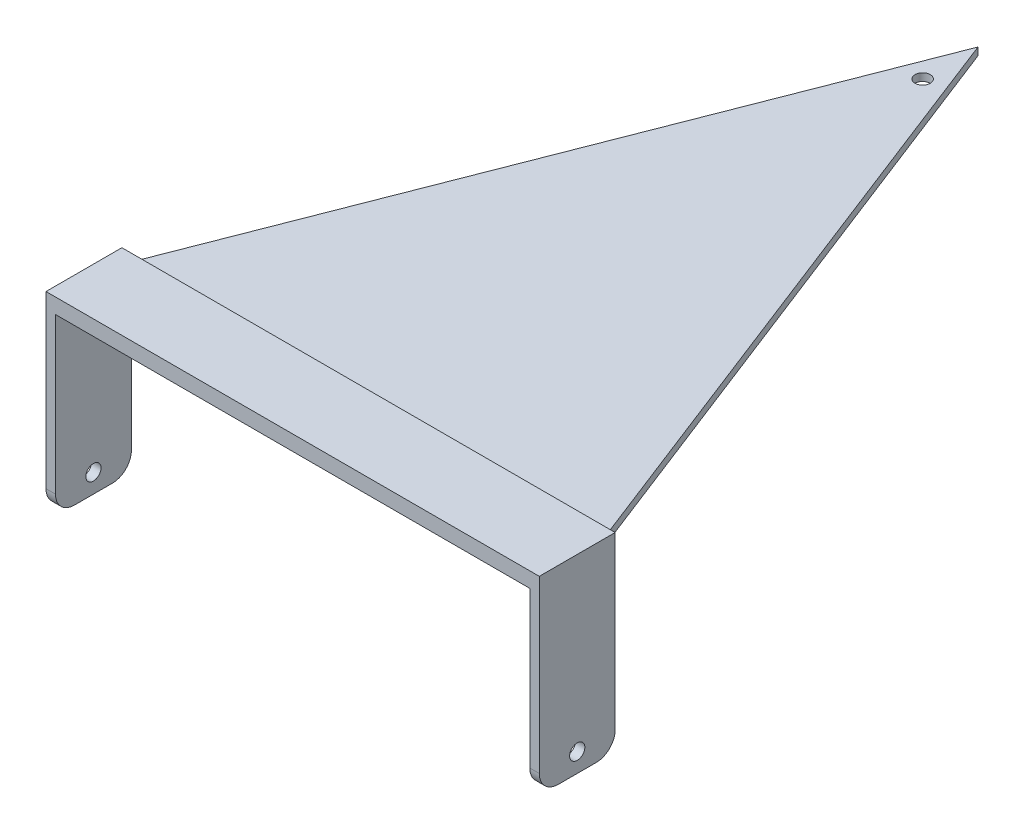
from build123d import *

# Parameters (mm, degrees)
SKETCH2_R           = 2
BOSS_EXTRUDE1_DEPTH = 2
SKETCH4_W           = 125
SKETCH4_H           = 20
BOSS_EXTRUDE4_DEPTH = 2
SKETCH7_W           = 2.5
SKETCH7_H           = 20
BOSS_EXTRUDE5_DEPTH = 50
FILLET1_R           = 5
SKETCH9_R           = 2
CUT_EXTRUDE1_DEPTH  = 250


with BuildPart() as part:
    # Sketch2 → Boss-Extrude1 (new body)
    with BuildSketch(Plane(origin=(0, 0, 0), x_dir=(1, 0, 0), z_dir=(0, 1, 0))):
        Polygon((125, 0), (125, 10), (62.5, 170.616846689), (0, 10), (0, 0), (0, -10), (125, -10), align=None)
        with Locations((62.5, 156.024837766)):
            Circle(SKETCH2_R, mode=Mode.SUBTRACT)
    extrude(amount=BOSS_EXTRUDE1_DEPTH)

    # Sketch4 → Boss-Extrude4 (add)
    with BuildSketch(Plane(origin=(0, 2, 0), x_dir=(1, 0, 0), z_dir=(0, 1, 0))):
        with Locations((62.5, 0)):
            Rectangle(SKETCH4_W, SKETCH4_H)
    extrude(amount=BOSS_EXTRUDE4_DEPTH)

    # Sketch7 → Boss-Extrude5 (add)
    with BuildSketch(Plane(origin=(0, 4, 0), x_dir=(1, 0, 0), z_dir=(0, 1, 0))):
        with Locations((-1.25, 0)):
            Rectangle(SKETCH7_W, SKETCH7_H)
        with Locations((126.25, 0)):
            Rectangle(SKETCH7_W, SKETCH7_H)
    extrude(amount=-BOSS_EXTRUDE5_DEPTH)

    # Fillet1
    fillet1_edges = [part.edges().sort_by_distance(p)[0] for p in [
        (126.25, -46, 10),
        (126.25, -46, -10),
        (-1.25, -46, -10),
        (-1.25, -46, 10),
    ]]
    fillet(fillet1_edges, radius=FILLET1_R)

    # Sketch9 → Cut-Extrude1 (cut)
    with BuildSketch(Plane.ZY.offset(2.5)):
        with Locations((0, -41)):
            Circle(SKETCH9_R)
    extrude(amount=-CUT_EXTRUDE1_DEPTH, mode=Mode.SUBTRACT)


solid = part.part
